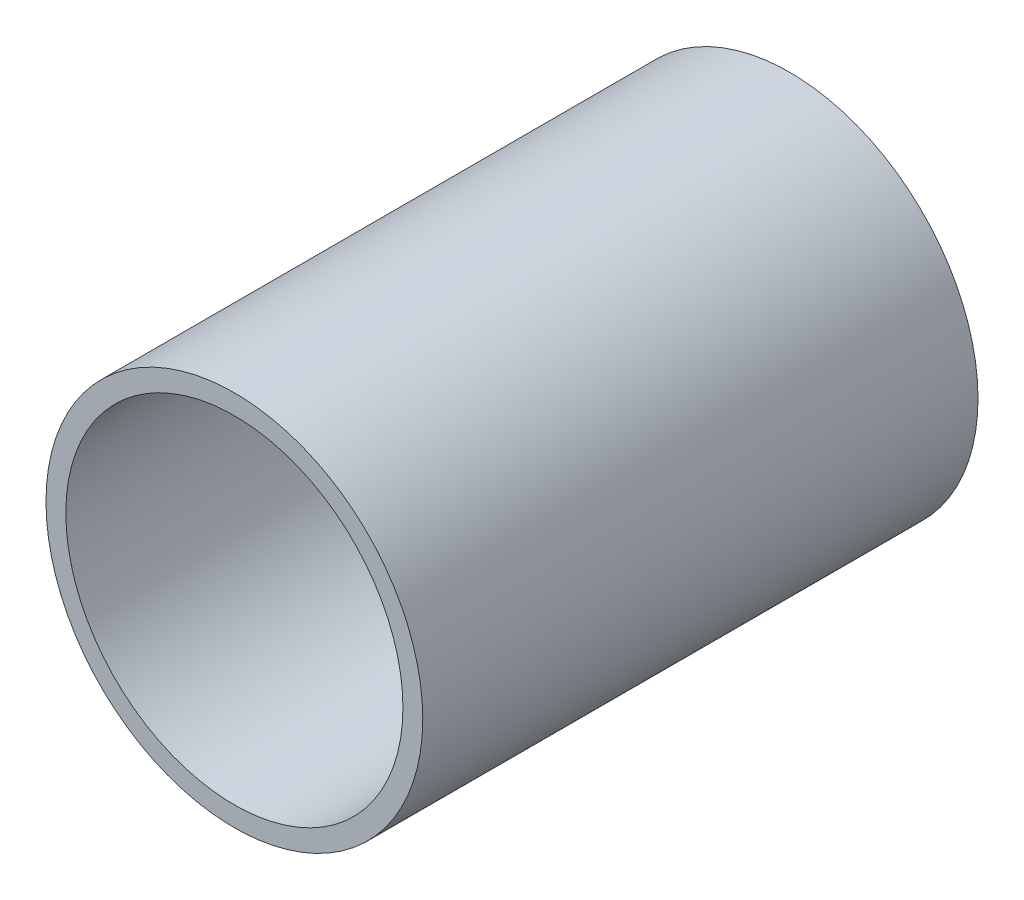
from build123d import *

# Parameters (mm, degrees)
SKETCH1_R           = 60.325
BOSS_EXTRUDE1_DEPTH = 177.8
SKETCH2_R           = 31.75
CUT_EXTRUDE1_DEPTH  = 198.208141947
SKETCH3_R           = 53.975
CUT_EXTRUDE2_DEPTH  = 165.1


with BuildPart() as part:
    # Sketch1 → Boss-Extrude1 (new body)
    with BuildSketch(Plane.XY):
        Circle(SKETCH1_R)
    extrude(amount=BOSS_EXTRUDE1_DEPTH)

    # Sketch2 → Cut-Extrude1 (cut, through all)
    with BuildSketch(Plane.XY.offset(177.8)):
        Circle(SKETCH2_R)
    extrude(amount=-CUT_EXTRUDE1_DEPTH, mode=Mode.SUBTRACT)

    # Sketch3 → Cut-Extrude2 (cut)
    with BuildSketch(Plane.XY.offset(177.8)):
        Circle(SKETCH3_R)
    extrude(amount=-CUT_EXTRUDE2_DEPTH, mode=Mode.SUBTRACT)


solid = part.part
